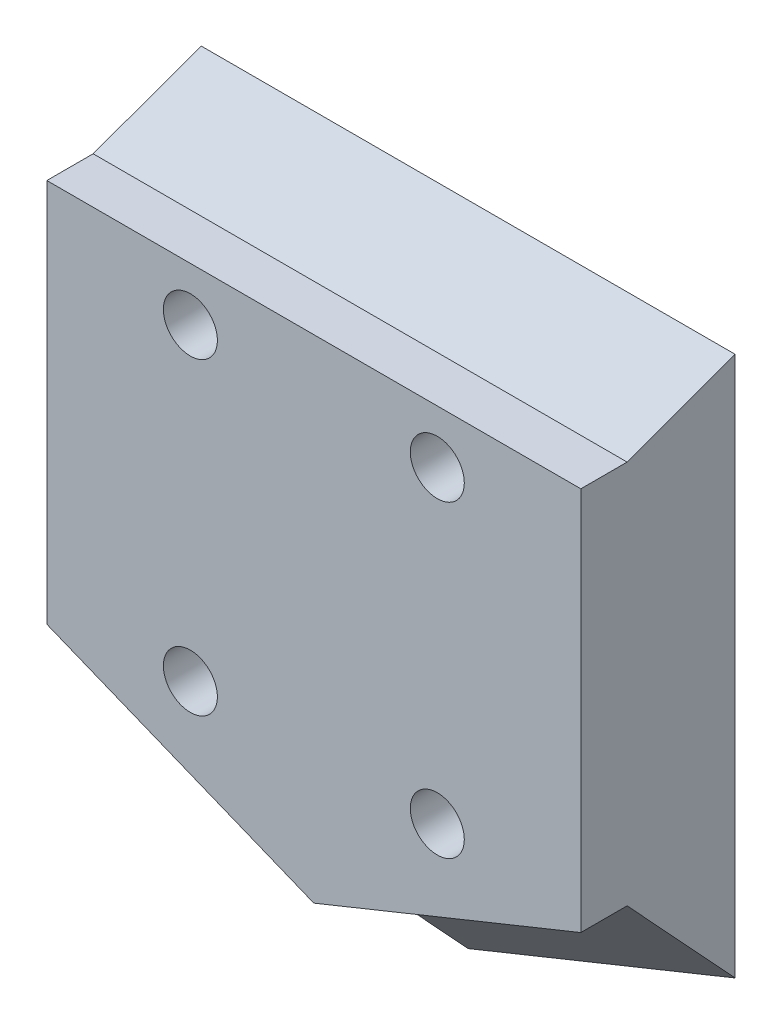
from build123d import *

# Parameters (mm, degrees)
ESBO_O1_W                = 34.6
ESBO_O1_H                = 26
RESSALTO_EXTRUS_O1_DEPTH = 7
ESBO_O10_W               = 34.6
ESBO_O10_H               = 2.5
RESSALTO_EXTRUS_O4_DEPTH = 7
CHANFRO1_SIZE            = 7
CHANFRO2_SIZE2           = 7
CHANFRO2_SIZE            = 2.54779164
RESSALTO_EXTRUS_O5_DEPTH = 3
ESBO_O11_R               = 1.75
CORTE_EXTRUS_O1_DEPTH    = 10
ESBO_O12_R               = 3.5
CORTE_EXTRUS_O2_DEPTH    = 3


with BuildPart() as part:
    # Esboço1 → Ressalto-extrusão1 (new body)
    with BuildSketch(Plane.XY):
        Rectangle(ESBO_O1_W, ESBO_O1_H)
    extrude(amount=RESSALTO_EXTRUS_O1_DEPTH)

    # Esboço10 → Ressalto-extrusão4 (add)
    with BuildSketch(Plane(origin=(0, 0, 0), x_dir=(-1, 0, 0), z_dir=(0, 0, -1))):
        Polygon((-17.3, -19.5), (0, -26.5), (17.3, -19.5), (17.3, -13), (-17.3, -13), align=None)
        with Locations((0, 14.25)):
            Rectangle(ESBO_O10_W, ESBO_O10_H)
    extrude(amount=-RESSALTO_EXTRUS_O4_DEPTH)

    # Chanfro1
    chanfro1_edges = [part.edges().sort_by_distance(p)[0] for p in [
        (8.65, -23, 7),
        (-8.65, -23, 7),
    ]]
    chamfer(chanfro1_edges, length=CHANFRO1_SIZE - 0.0001)  # a hair under: the kernel refuses the full size

    # Chanfro2
    chanfro2_edges = [part.edges().sort_by_distance(p)[0] for p in [
        (0, 15.5, 7),
    ]]
    chanfro2_side = [part.faces().sort_by_distance(p)[0] for p in [
        (0, 15.449044167, 7),
    ]]
    chamfer(chanfro2_edges, length=CHANFRO2_SIZE - 0.0001, length2=CHANFRO2_SIZE2 - 0.0001, reference=chanfro2_side[0])  # a hair under: the kernel refuses the full size

    # Esboço13 → Ressalto-extrusão5 (add)
    with BuildSketch(Plane.XY.offset(7)):
        Polygon((17.3, -11.948687565), (17.3, 12.95220836), (-17.3, 12.95220836), (-17.3, -11.948687565), (0, -18.948687565), align=None)
    extrude(amount=RESSALTO_EXTRUS_O5_DEPTH)

    # Esboço11 → Corte-extrusão1 (cut)
    with BuildSketch(Plane.XY.offset(10)):
        with Locations((8, 9.5)):
            Circle(ESBO_O11_R)
        with Locations((8, -10.5)):
            Circle(ESBO_O11_R)
        with Locations(Location((-8, -10.5, 0), (0, 0, 180))):
            Circle(ESBO_O11_R)
        with Locations(Location((-8, 9.5, 0), (0, 0, 180))):
            Circle(ESBO_O11_R)
    extrude(amount=-CORTE_EXTRUS_O1_DEPTH, mode=Mode.SUBTRACT)

    # Esboço12 → Corte-extrusão2 (cut)
    with BuildSketch(Plane(origin=(0, 0, 0), x_dir=(-1, 0, 0), z_dir=(0, 0, -1))):
        with Locations((-8, 9.5)):
            Circle(ESBO_O12_R)
        with Locations((8, 9.5)):
            Circle(ESBO_O12_R)
        with Locations((-8, -10.5)):
            Circle(ESBO_O12_R)
        with Locations((8, -10.5)):
            Circle(ESBO_O12_R)
    extrude(amount=-CORTE_EXTRUS_O2_DEPTH, mode=Mode.SUBTRACT)


solid = part.part
